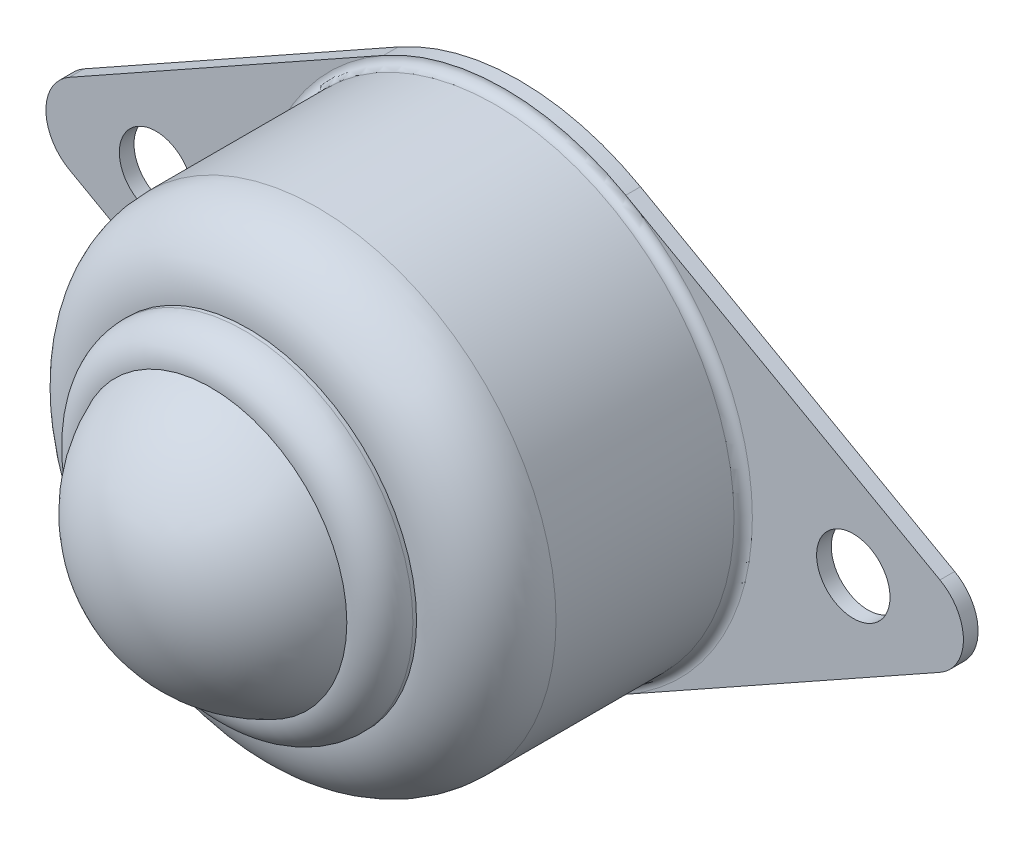
from build123d import *

# Parameters (mm, degrees)
SALIENTE_EXTRUIR1_DEPTH = 0.8
CROQUIS2_R              = 2
CORTAR_EXTRUIR1_DEPTH   = 10.8
CROQUIS3_R              = 13
SALIENTE_EXTRUIR2_DEPTH = 14
REDONDEO1_R             = 3.8
CROQUIS4_R              = 9.2
SALIENTE_EXTRUIR3_DEPTH = 2
REDONDEO2_R             = 1.8
C_PULA2_FACE_RADIUS     = 7.4
C_PULA2_HEIGHT          = 5
REDONDEO3_R             = 0.5


with BuildPart() as part:
    # Croquis1 → Saliente-Extruir1 (new body)
    with BuildSketch(Plane.XY):
        with BuildLine():
            Line((23.722222222, 2.180865158), (6.6, 11.776671856))
            ThreePointArc((6.6, 11.776671856), (0, 13.5), (-6.6, 11.776671856))
            Line((-6.6, 11.776671856), (-23.722222222, 2.180865158))
            ThreePointArc((-23.722222222, 2.180865158), (-25, 0), (-23.722222222, -2.180865158))
            Line((-23.722222222, -2.180865158), (-6.6, -11.776671856))
            ThreePointArc((-6.6, -11.776671856), (0, -13.5), (6.6, -11.776671856))
            Line((6.6, -11.776671856), (23.722222222, -2.180865158))
            ThreePointArc((23.722222222, -2.180865158), (25, 0), (23.722222222, 2.180865158))
        make_face()
    extrude(amount=SALIENTE_EXTRUIR1_DEPTH)

    # Croquis2 → Cortar-Extruir1 (cut)
    with BuildSketch(Plane.XY.offset(0.8)):
        with Locations((-19, 0)):
            Circle(CROQUIS2_R)
        with Locations((19, 0)):
            Circle(CROQUIS2_R)
    extrude(amount=-CORTAR_EXTRUIR1_DEPTH, mode=Mode.SUBTRACT)

    # Croquis3 → Saliente-Extruir2 (add)
    with BuildSketch(Plane.XY.offset(0.8)):
        Circle(CROQUIS3_R)
    extrude(amount=SALIENTE_EXTRUIR2_DEPTH)

    # Redondeo1
    redondeo1_edges = [part.edges().sort_by_distance(p)[0] for p in [
        (-13, 0, 14.8),
    ]]
    fillet(redondeo1_edges, radius=REDONDEO1_R)

    # Croquis4 → Saliente-Extruir3 (add)
    with BuildSketch(Plane.XY.offset(14.8)):
        Circle(CROQUIS4_R)
    extrude(amount=SALIENTE_EXTRUIR3_DEPTH)

    # Redondeo2
    redondeo2_edges = [part.edges().sort_by_distance(p)[0] for p in [
        (-9.2, 0, 16.8),
    ]]
    fillet(redondeo2_edges, radius=REDONDEO2_R)

    # Cúpula2: a dome of height H over a round flat face of radius A is a cap of a sphere of radius (A * A + H * H) / (2 * H)
    c_pula2_r = (C_PULA2_FACE_RADIUS * C_PULA2_FACE_RADIUS + C_PULA2_HEIGHT * C_PULA2_HEIGHT) / (2 * C_PULA2_HEIGHT)
    c_pula2_base = Plane((0, 0, 16.8), z_dir=(0, 0, 1))
    with Locations(c_pula2_base.offset(C_PULA2_HEIGHT - c_pula2_r)):
        c_pula2_ball = Sphere(c_pula2_r, mode=Mode.PRIVATE)
    add(split(c_pula2_ball, bisect_by=c_pula2_base, keep=Keep.TOP, mode=Mode.PRIVATE))

    # Redondeo3
    redondeo3_edges = [part.edges().sort_by_distance(p)[0] for p in [
        (-13, 0, 0.8),
    ]]
    fillet(redondeo3_edges, radius=REDONDEO3_R - 0.0001)  # a hair under: the kernel refuses the full size


solid = part.part
